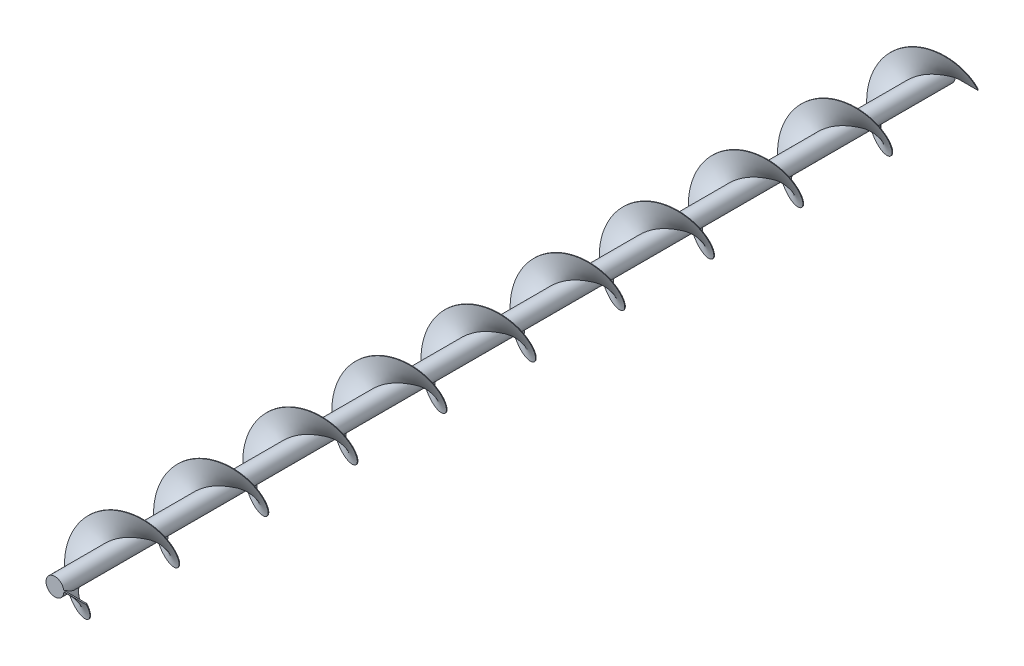
from build123d import *

# Parameters (mm, degrees)
SKIZZE1_R                       = 5
AUFSATZ_LINEAR_AUSTRAGEN1_DEPTH = 500
AUSTRAGUNG3_PITCH               = 50
AUSTRAGUNG3_HEIGHT              = 500
AUSTRAGUNG3_RADIUS              = 18.068157361
SKIZZE5_W                       = 17.820638892
SKIZZE5_H                       = 0.776134031


with BuildPart() as part:
    # Skizze1 → Aufsatz-Linear austragen1 (new body)
    with BuildSketch(Plane.XY):
        Circle(SKIZZE1_R)
    extrude(amount=AUFSATZ_LINEAR_AUSTRAGEN1_DEPTH)

    # Austragung3: sweep along a helix
    with BuildLine() as austragung3_path:
        Helix(AUSTRAGUNG3_PITCH, AUSTRAGUNG3_HEIGHT, AUSTRAGUNG3_RADIUS, center=(0, 0, 0), direction=(0, 0, 1))
    # Skizze5 → Austragung3 (sweep)
    with BuildSketch(Plane(origin=(0, 0, 0), x_dir=(-1, 0, 0), z_dir=(0, 0, -1))):
        with Locations((-8.910319446, 0.388067016)):
            Rectangle(SKIZZE5_W, SKIZZE5_H)
    sweep(path=austragung3_path.line, is_frenet=True)


solid = part.part
